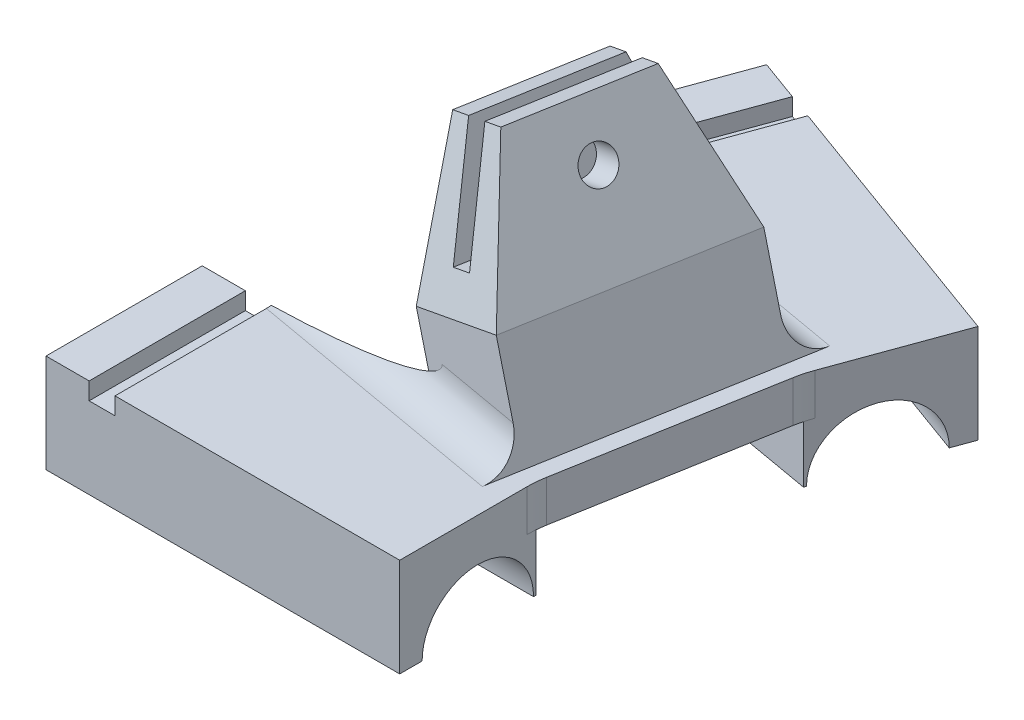
from build123d import *

# Parameters (mm, degrees)
SKETCH2_W                  = 58.42
SKETCH2_H                  = 23
TWOLEGS_DEPTH              = 14.5
LEGSLOTS_DEPTH             = 62.281289151
SKETCH6_W                  = 3.81
SKETCH6_H                  = 2.54
GROOVE_DEPTH               = 25.4
MIDDLEBRIDGECUT_DEPTH      = 25.4
SKETCH8_W                  = 17
SKETCH8_H                  = 14.5
BRIDGE_DEPTH               = 17
BRIDGEUNDERCUT_REACH       = 53.567
SKETCH15_W                 = 17
SKETCH15_H                 = 8.4
MIRROR14_START             = 10.281893146
MIRROR14_OUTLINE_W         = 6.1
MIRROR14_OUTLINE_H         = 17
MIRROR14_DEPTH             = 17
CLAMPINCLINE_DEPTH         = 17
EXTRUDECONNECTOR_DEPTH     = 35.56
CONNECTORDRAFT_REACH       = 111.361
CONNECTORGROOVE_REACH      = 94.034
CONNECTORHOLE_REACH        = 111.361
SKETCH25_R                 = 2.4765
SKETCH26_R                 = 3.15
BRIDGEHOLE_DEPTH           = 4.5
FILLET1_R                  = 15.24
FILLET2_R                  = 5.08
CONNECTORDRAFT2_DEPTH      = 93.034308057
CONNECTORDRAFT2_DEPTH_BACK = 93.034308057
LEGSHORTEN_REACH           = 98.848
SKETCH28_W                 = 6.35
SKETCH28_H                 = 23


with BuildPart() as part:
    # Sketch2 → twolegs (new body)
    with BuildSketch(Plane(origin=(0, 0, 0), x_dir=(1, 0, 0), z_dir=(0, 1, 0))):
        Rectangle(SKETCH2_W, SKETCH2_H)
    twolegs = extrude(amount=TWOLEGS_DEPTH)

    # Sketch4 → legslots (cut, symmetric)
    with BuildSketch(Plane.ZY.offset(29.21)):
        with BuildLine():
            Line((-8.2, -58.921978701), (-8.2, 0))
            ThreePointArc((-8.2, 0), (0, 8.2), (8.2, 0))
            Line((8.2, 0), (8.2, -58.921978701))
            Line((8.2, -58.921978701), (8.2, -176.765936102))
            Line((8.2, -176.765936102), (-8.2, -176.765936102))
            Line((-8.2, -176.765936102), (-8.2, -58.921978701))
        make_face()
    legslots = extrude(amount=LEGSLOTS_DEPTH, both=True, mode=Mode.SUBTRACT)

    # Sketch6 → groove (cut)
    with BuildSketch(Plane(origin=(0, 0, -11.5), x_dir=(-1, 0, 0), z_dir=(0, 0, -1))):
        with Locations((14.605, 13.23)):
            Rectangle(SKETCH6_W, SKETCH6_H)
    groove = extrude(amount=-GROOVE_DEPTH, mode=Mode.SUBTRACT)

    # Sketch7 → middlebridgecut (cut)
    with BuildSketch(Plane(origin=(0, 14.5, 0), x_dir=(1, 0, 0), z_dir=(0, 1, 0))):
        Polygon((12.468268199, 11.5), (29.21, 8.54798098), (29.21, 11.5), align=None)
    extrude(amount=-MIDDLEBRIDGECUT_DEPTH, mode=Mode.SUBTRACT)

    # Sketch8 → bridge (add)
    with BuildSketch(Plane(origin=(2.342580113, 0, -13.285432008), x_dir=(-0.9848077530122094, 0, -0.17364817766692317), z_dir=(0.17364817766692317, 0, -0.9848077530122094))):
        with Locations((-18.781893146, 7.25)):
            Rectangle(SKETCH8_W, SKETCH8_H)
    extrude(amount=BRIDGE_DEPTH)

    # Sketch15 → bridgeundercut (cut, up to next)
    with BuildSketch(Plane(origin=(10.125688085, 0, 1.785432008), x_dir=(-0.17364817766692317, 0, 0.9848077530122095), z_dir=(-0.9848077530122095, 0, -0.17364817766692317)), mode=Mode.PRIVATE) as bridgeundercut_sk1:
        with Locations((-21.990381211, 4.2)):
            Rectangle(SKETCH15_W, SKETCH15_H)
    bridgeundercut_tool1 = extrude(bridgeundercut_sk1.sketch, amount=-BRIDGEUNDERCUT_REACH, mode=Mode.PRIVATE) & part.part
    bridgeundercut = bridgeundercut_tool1.solids().sort_by_distance((13.944278, 4.2, -19.870866))[0]
    add(bridgeundercut, mode=Mode.SUBTRACT)

    # Mirror14: read off the stored shape, not the designer's step
    # Mirror14 outline → Mirror14 (add)
    with BuildSketch(Plane(origin=(0, 0, 0), x_dir=(0, 1, 0), z_dir=(0.9848077530122094, 0, 0.17364817766692306)).offset(MIRROR14_START)):
        with Locations((11.45, -38.990381211)):
            Rectangle(MIRROR14_OUTLINE_W, MIRROR14_OUTLINE_H)
    extrude(amount=MIRROR14_DEPTH)

    # Mirror15: twolegs across plane
    add(twolegs.mirror(Plane(origin=(5.294599134, 0, -30.027163809), x_dir=(0.9848077530122092, 0, 0.17364817766692314), z_dir=(0.17364817766692314, 0, -0.9848077530122094))))

    # Mirror16: legslots, groove, bridgeundercut across plane
    add(legslots.mirror(Plane(origin=(5.294599134, 0, -30.027163809), x_dir=(0.9848077530122092, 0, 0.17364817766692314), z_dir=(0.17364817766692314, 0, -0.9848077530122094))), mode=Mode.SUBTRACT)
    add(groove.mirror(Plane(origin=(5.294599134, 0, -30.027163809), x_dir=(0.9848077530122092, 0, 0.17364817766692314), z_dir=(0.17364817766692314, 0, -0.9848077530122094))), mode=Mode.SUBTRACT)
    add(bridgeundercut.mirror(Plane(origin=(5.294599134, 0, -30.027163809), x_dir=(0.9848077530122092, 0, 0.17364817766692314), z_dir=(0.17364817766692314, 0, -0.9848077530122094))), mode=Mode.SUBTRACT)

    # Sketch21 → clampincline (cut, symmetric)
    with BuildSketch(Plane(origin=(5.294599134, 0, -30.027163809), x_dir=(-0.9848077530122094, 0, -0.17364817766692314), z_dir=(0.17364817766692314, 0, -0.9848077530122094))):
        Polygon((-24.800533146, 14.5), (-10.281893146, 9.782607901), (-10.281893146, 14.5), align=None)
    extrude(amount=CLAMPINCLINE_DEPTH, both=True, mode=Mode.SUBTRACT)

    # Sketch22 → extrudeconnector (add)
    with BuildSketch(Plane(origin=(-1.864440892, 5.826679393, -0.328751233), x_dir=(-0.19370062592752282, -0.006629130978421877, 0.98103828780418), z_dir=(-0.30432233187297286, 0.9510565162951554, -0.05366023794131847))):
        Polygon((-48.081564355, 27.0422172), (-14.089388689, 27.771596028), (-13.761901853, 12.509307601), (-47.754077519, 11.779928772), align=None)
    extrude(amount=EXTRUDECONNECTOR_DEPTH)

    # Sketch23 → connectordraft (cut, up to next)
    with BuildSketch(Plane(origin=(26.288198213, 8.673320607, 4.635318619), x_dir=(0.3484357800023436, -0.8710369750422688, -0.34624715930007605), z_dir=(0.9366078308002519, 0.30901699437494146, 0.16514923091290587)), mode=Mode.PRIVATE) as connectordraft_sk1:
        Polygon((-21.922562345, 53.820435592), (-0.501791973, 52.073152935), (-19.112117469, 60.231472918), align=None)
    connectordraft_tool1 = extrude(connectordraft_sk1.sketch, amount=-CONNECTORDRAFT_REACH, mode=Mode.PRIVATE) & part.part
    # Sketch23 → connectordraft (cut, up to next)
    with BuildSketch(Plane(origin=(26.288198213, 8.673320607, 4.635318619), x_dir=(0.3484357800023436, -0.8710369750422688, -0.34624715930007605), z_dir=(0.9366078308002519, 0.30901699437494146, 0.16514923091290587)), mode=Mode.PRIVATE) as connectordraft_sk2:
        Polygon((-14.152524229, 20.933828779), (-32.762849725, 29.092148762), (-29.952404848, 35.503186089), align=None)
    connectordraft_tool2 = extrude(connectordraft_sk2.sketch, amount=-CONNECTORDRAFT_REACH, mode=Mode.PRIVATE) & part.part
    add(connectordraft_tool1.solids().sort_by_distance((23.504771, 41.877747, -41.709143))[0], mode=Mode.SUBTRACT)
    add(connectordraft_tool2.solids().sort_by_distance((18.411091, 41.877747, -12.821449))[0], mode=Mode.SUBTRACT)

    # connectorgroove: up to this plane
    connectorgroove_end = Plane(origin=(-43.786464147, 27.065475321, -48.835745626), z_dir=(-0.06506049659943954, -0.3097627963249175, 0.9485853371179643))
    # Sketch24 → connectorgroove (cut, up to the surface)
    with BuildSketch(Plane(origin=(2.342580113, 0, -13.285432008), x_dir=(-0.9848077530122095, 0, -0.1736481776669232), z_dir=(0.1736481776669232, 0, -0.9848077530122095)), mode=Mode.PRIVATE) as connectorgroove_sk1:
        Polygon((-9.788420854, 30.987981431), (-12.735554786, 31.945563293), (-8.026135792, 46.439664601), (-5.079001859, 45.482082739), align=None)
    connectorgroove_tool1 = split(extrude(connectorgroove_sk1.sketch, amount=CONNECTORGROOVE_REACH, mode=Mode.PRIVATE), bisect_by=connectorgroove_end, keep=Keep.BOTH, mode=Mode.PRIVATE)
    add(connectorgroove_tool1.solids().sort_by_distance((11.114537, 38.713823, -11.738699))[0], mode=Mode.SUBTRACT)

    # connectorhole: up to this face of the body (flat: up to its plane)
    connectorhole_end = Plane(part.part.faces().sort_by_distance((10.456046087, 25.296664487, -29.117061452))[0])
    # Sketch25 → connectorhole (cut, up to the picked face)
    with BuildSketch(Plane(origin=(26.288198213, 8.673320607, 4.635318619), x_dir=(0.3484357800023436, -0.8710369750422688, -0.34624715930007605), z_dir=(0.9366078308002519, 0.30901699437494146, 0.16514923091290587)), mode=Mode.PRIVATE) as connectorhole_sk1:
        with Locations(Location((-18.958611536, 41.602440846, 0), (0, 0, 159.447358614))):
            Circle(SKETCH25_R)
    connectorhole_tool1 = split(extrude(connectorhole_sk1.sketch, amount=-CONNECTORHOLE_REACH, mode=Mode.PRIVATE), bisect_by=connectorhole_end, keep=Keep.BOTH, mode=Mode.PRIVATE)
    add(connectorhole_tool1.solids().sort_by(Axis((21.215591, 41.072519, -27.219863), (-0.9366078308002519, -0.30901699437494146, -0.16514923091290587)))[0], mode=Mode.SUBTRACT)

    # Sketch26 → bridgehole (cut)
    with BuildSketch(Plane.XZ.offset(-8.4)):
        with Locations(Location((24.012358933, -26.726717738, 0), (0, 0, 270))):
            Circle(SKETCH26_R)
    extrude(amount=-BRIDGEHOLE_DEPTH, mode=Mode.SUBTRACT)

    # Fillet1
    fillet1_edges = [part.edges().sort_by_distance(p)[0] for p in [
        (29.21, 11.45, -8.54798098),
        (35.114038041, 11.45, -42.031444582),
    ]]
    fillet(fillet1_edges, radius=FILLET1_R)

    # Fillet2
    # the kernel refuses this fillet: 5.08 mm, written as the material it adds along each edge
    with BuildSketch(Plane(origin=(-25.052907191, 14.5, -18.115995569), x_dir=(-0.17364817766692314, 0, 0.9848077530122094), z_dir=(0.9848077530122094, 0, 0.17364817766692314))) as fillet2_piece_1_section:
        with BuildLine():
            CenterArc((FILLET2_R, -FILLET2_R), FILLET2_R, 90, 90)
            Line((0, -FILLET2_R), (0, 0))
            Line((0, 0), (FILLET2_R, 0))
        make_face()
    fillet2_piece_1 = extrude(amount=65.31864, mode=Mode.PRIVATE)
    fillet2_piece_1 = split(fillet2_piece_1, bisect_by=Plane(origin=(-12.7, 14.5, -18.115995569), z_dir=(1, 0, 0)), keep=Keep.TOP, mode=Mode.PRIVATE)
    fillet2_piece_1 = split(fillet2_piece_1, bisect_by=Plane(origin=(-25.052907191, 14.5, -11.5), z_dir=(0, 0, 1)), keep=Keep.TOP, mode=Mode.PRIVATE)
    fillet2_piece_1 = split(fillet2_piece_1, bisect_by=Plane(origin=(21.81803989, 29.964230294, -9.851382987), z_dir=(-0.9366078308002517, -0.30901699437494173, -0.16514923091290615)), keep=Keep.TOP, mode=Mode.PRIVATE)
    add(fillet2_piece_1)
    with BuildSketch(Plane(origin=(-19.14886915, 14.5, -51.599459172), x_dir=(0.17364817766692314, 0, -0.9848077530122094), z_dir=(0.9848077530122094, 0, 0.17364817766692314))) as fillet2_piece_2_section:
        with BuildLine():
            CenterArc((FILLET2_R, FILLET2_R), FILLET2_R, 180, 90)
            Line((0, FILLET2_R), (0, 0))
            Line((0, 0), (FILLET2_R, 0))
        make_face()
    fillet2_piece_2 = extrude(amount=65.31864, mode=Mode.PRIVATE)
    fillet2_piece_2 = split(fillet2_piece_2, bisect_by=Plane(origin=(27.722077931, 29.964230294, -43.33484659), z_dir=(-0.9366078308002517, -0.30901699437494173, -0.16514923091290615)), keep=Keep.TOP, mode=Mode.PRIVATE)
    fillet2_piece_2 = split(fillet2_piece_2, bisect_by=Plane(origin=(-7.540933418, 14.5, -47.374516084), z_dir=(0.9396926207859135, 0, 0.342020143325655)), keep=Keep.TOP, mode=Mode.PRIVATE)
    fillet2_piece_2 = split(fillet2_piece_2, bisect_by=Plane(origin=(-16.886065398, 14.5, -57.816461387), z_dir=(0.342020143325655, 0, -0.9396926207859134)), keep=Keep.TOP, mode=Mode.PRIVATE)
    add(fillet2_piece_2)

    # Sketch27 → connectordraft2 (cut, two sides: drawn at the far end of the back side and taken through both)
    with BuildSketch(Plane(origin=(2.342580113, 0, -13.285432008), x_dir=(-0.9848077530122095, 0, -0.1736481776669232), z_dir=(0.1736481776669232, 0, -0.9848077530122095)).offset(-CONNECTORDRAFT2_DEPTH_BACK)):
        Polygon((-10.919012309, 47.37961716), (-20.091114151, 28.994101308), (-13.811888826, 48.319569719), align=None)
        Polygon((-2.186125342, 44.54213018), (-5.572474151, 24.27670921), (0.706751174, 43.602177621), align=None)
    extrude(amount=CONNECTORDRAFT2_DEPTH + CONNECTORDRAFT2_DEPTH_BACK, mode=Mode.SUBTRACT)

    # legshorten: up to this face of the body (flat: up to its plane)
    legshorten_end = Plane(part.part.faces().sort_by_distance((-3.474076782, 0, -9.752083384))[0])
    # Sketch28 → legshorten (cut, up to the picked face)
    with BuildSketch(Plane(origin=(0, 14.5, 0), x_dir=(1, 0, 0), z_dir=(0, 1, 0)), mode=Mode.PRIVATE) as legshorten_sk1:
        with Locations((-26.035, 0)):
            Rectangle(SKETCH28_W, SKETCH28_H)
    legshorten_tool1 = split(extrude(legshorten_sk1.sketch, amount=-LEGSHORTEN_REACH, mode=Mode.PRIVATE), bisect_by=legshorten_end, keep=Keep.BOTH, mode=Mode.PRIVATE)
    legshorten = legshorten_tool1.solids().sort_by(Axis((-26.035, 14.5, 0), (0, -1, 0)))[0]
    add(legshorten, mode=Mode.SUBTRACT)

    # Mirror17: legshorten across plane
    add(legshorten.mirror(Plane(origin=(5.294599134, 0, -30.027163809), x_dir=(0.9848077530122092, 0, 0.17364817766692314), z_dir=(0.17364817766692314, 0, -0.9848077530122094))), mode=Mode.SUBTRACT)


solid = part.part
